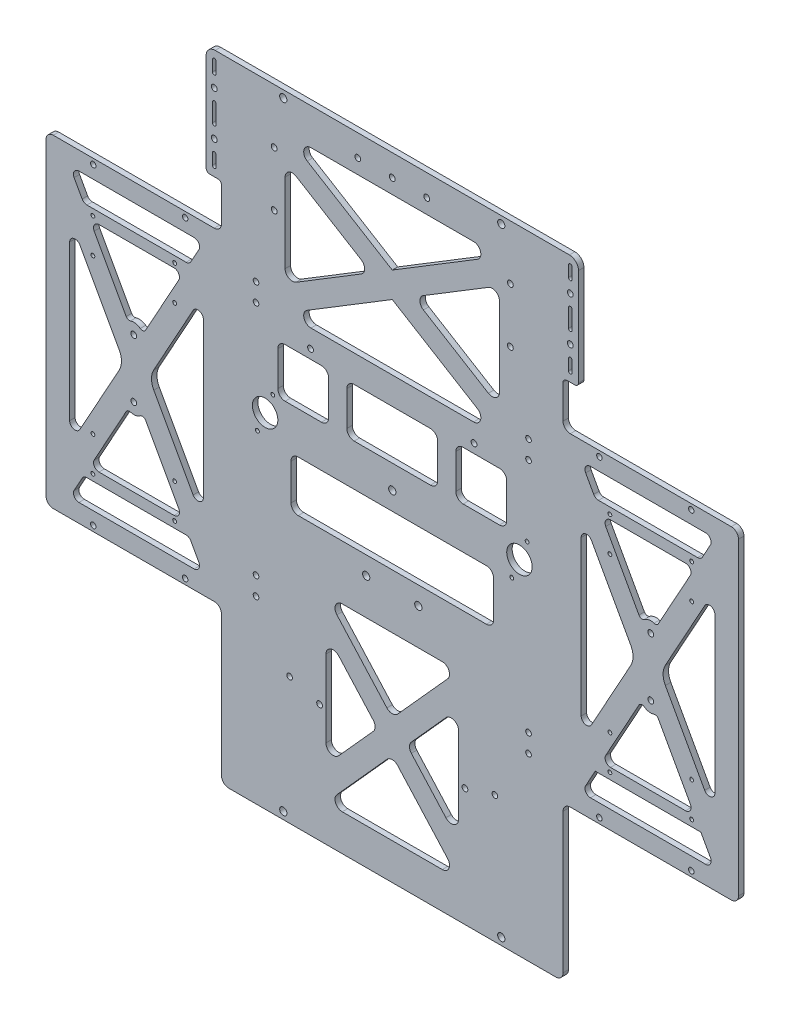
from build123d import *

# Parameters (mm, degrees)
EXTRUDE_1_DEPTH      = 3
SKETCH_2_R           = 1.5
SKETCH_2_W           = 73.6
SKETCH_2_H           = 158
CUT_EXTRUDE_1_DEPTH  = 259.095641188
SKETCH_3_R           = 1.6
SKETCH_3_R_2         = 1.05
EXTRUDE_2_DEPTH      = 3
FILLET_2_R           = 4
SKETCH_4_R           = 2
CUT_EXTRUDE_2_DEPTH  = 259.095641188
FILLET_3_R           = 2
FILLET_4_R           = 3
FILLET_5_R           = 10
SKETCH_19_W          = 8.5
SKETCH_19_H          = 60.5
EXTRUDE_3_DEPTH      = 3
SKETCH_20_W          = 2
SKETCH_20_H          = 6
SKETCH_20_H_2        = 10
CUT_EXTRUDE_13_DEPTH = 259.095641188
SKETCH_22_R          = 1.6
SKETCH_22_R_2        = 1
CUT_EXTRUDE_14_DEPTH = 259.095641188
SKETCH_23_R          = 1.6
SKETCH_23_R_2        = 2
SKETCH_23_R_3        = 1.05
SKETCH_23_R_4        = 1.55
SKETCH_23_R_5        = 7
CUT_EXTRUDE_15_DEPTH = 259.095641188
SKETCH_24_R          = 1.55
CUT_EXTRUDE_16_DEPTH = 259.095641188
SKETCH_26_W          = 118
SKETCH_26_H          = 86
SKETCH_26_W_2        = 126
SKETCH_26_H_2        = 27
SKETCH_26_W_3        = 111.55
SKETCH_26_H_3        = 27.9
SKETCH_26_W_4        = 73
SKETCH_26_H_4        = 99.1
CUT_EXTRUDE_17_DEPTH = 259.095641188
SKETCH_27_W          = 10
SKETCH_27_H          = 27
EXTRUDE_4_DEPTH      = 3
FILLET_6_R           = 4
FILLET_7_R           = 2
FILLET_8_R           = 5
SKETCH_29_R          = 1.6
CUT_EXTRUDE_18_DEPTH = 259.095641188
SKETCH_30_R          = 1.6
CUT_EXTRUDE_19_DEPTH = 259.095641188


with BuildPart() as part:
    # 草图1 → 凸台-拉伸1 (new body)
    with BuildSketch(Plane.XY):
        Polygon((-94, -89), (-94, -174), (94, -174), (94, -89), (190.6, -89), (190.6, 89), (94, 89), (94, 174), (-94, 174), (-94, 89), (-190.6, 89), (-190.6, -89), align=None)
    extrude(amount=EXTRUDE_1_DEPTH)

    # 草图2 → 切除-拉伸1 (cut, through all)
    with BuildSketch(Plane.XY.offset(3)):
        with Locations((164.6, 86)):
            Circle(SKETCH_2_R)
        with Locations((164.6, -86)):
            Circle(SKETCH_2_R)
        with Locations((-60, -170)):
            Circle(SKETCH_2_R)
        with Locations((60, -170)):
            Circle(SKETCH_2_R)
        with Locations((-164.6, -86)):
            Circle(SKETCH_2_R)
        with Locations((-164.6, 86)):
            Circle(SKETCH_2_R)
        with Locations((-60, 170)):
            Circle(SKETCH_2_R)
        with Locations((60, 170)):
            Circle(SKETCH_2_R)
        with Locations((-114, 86)):
            Circle(SKETCH_2_R)
        with Locations((-114, -86)):
            Circle(SKETCH_2_R)
        with Locations((114, 86)):
            Circle(SKETCH_2_R)
        with Locations((114, -86)):
            Circle(SKETCH_2_R)
        with Locations((-140.8, 0)):
            Rectangle(SKETCH_2_W, SKETCH_2_H)
        with Locations((140.8, 0)):
            Rectangle(SKETCH_2_W, SKETCH_2_H)
    extrude(amount=-CUT_EXTRUDE_1_DEPTH, mode=Mode.SUBTRACT)

    # 草图3 → 凸台-拉伸2 (add)
    # profile 1 of 2: a face of its own
    with BuildSketch(Plane.XY.offset(3)):
        Polygon((-177.6, 79), (-169.863644358, 65), (-111.736355642, 65), (-104, 79), (-104, 54.189326828), (-133.944850308, 0), (-104, -54.189326828), (-104, -79), (-111.736355642, -65), (-169.863644358, -65), (-177.6, -79), (-177.6, -54.189326828), (-147.655149692, 0), (-177.6, 54.189326828), align=None)
        with Locations((-142.3, 16)):
            Circle(SKETCH_3_R, mode=Mode.SUBTRACT)
        with Locations((-164.8, 61.5)):
            Circle(SKETCH_3_R_2, mode=Mode.SUBTRACT)
        with Locations((-119.8, 61.5)):
            Circle(SKETCH_3_R_2, mode=Mode.SUBTRACT)
        with Locations((-119.8, 42.5)):
            Circle(SKETCH_3_R_2, mode=Mode.SUBTRACT)
        with Locations((-164.8, 42.5)):
            Circle(SKETCH_3_R_2, mode=Mode.SUBTRACT)
        with Locations((-142.3, -16)):
            Circle(SKETCH_3_R, mode=Mode.SUBTRACT)
        with Locations((-119.8, -42.5)):
            Circle(SKETCH_3_R_2, mode=Mode.SUBTRACT)
        with Locations((-164.8, -42.5)):
            Circle(SKETCH_3_R_2, mode=Mode.SUBTRACT)
        with Locations((-119.8, -61.5)):
            Circle(SKETCH_3_R_2, mode=Mode.SUBTRACT)
        with Locations((-164.8, -61.5)):
            Circle(SKETCH_3_R_2, mode=Mode.SUBTRACT)
        with BuildLine():
            Line((-166.548063369, 59), (-115.051936631, 59))
            Line((-115.051936631, 59), (-137.130529886, 19.045747649))
            ThreePointArc((-137.130529886, 19.045747649), (-140.924767783, 21.840268517), (-145.567279017, 21.032383911))
            Line((-145.567279017, 21.032383911), (-166.548063369, 59))
        make_face(mode=Mode.SUBTRACT)
        with BuildLine():
            Line((-166.548063369, -59), (-115.051936631, -59))
            Line((-115.051936631, -59), (-137.130529886, -19.045747649))
            ThreePointArc((-137.130529886, -19.045747649), (-140.924767783, -21.840268517), (-145.567279017, -21.032383911))
            Line((-145.567279017, -21.032383911), (-166.548063369, -59))
        make_face(mode=Mode.SUBTRACT)
    # profile 2 of 2: a face of its own
    with BuildSketch(Plane.XY.offset(3)):
        Polygon((169.863644358, -65), (111.736355642, -65), (104, -79), (104, -54.189326828), (133.944850308, 0), (104, 54.189326828), (104, 79), (111.736355642, 65), (169.863644358, 65), (177.6, 79), (177.6, 54.189326828), (147.655149692, 0), (177.6, -54.189326828), (177.6, -79), align=None)
        with Locations((164.8, -61.5)):
            Circle(SKETCH_3_R_2, mode=Mode.SUBTRACT)
        with Locations((119.8, -61.5)):
            Circle(SKETCH_3_R_2, mode=Mode.SUBTRACT)
        with Locations((164.8, -42.5)):
            Circle(SKETCH_3_R_2, mode=Mode.SUBTRACT)
        with Locations((119.8, -42.5)):
            Circle(SKETCH_3_R_2, mode=Mode.SUBTRACT)
        with Locations((142.3, -16)):
            Circle(SKETCH_3_R, mode=Mode.SUBTRACT)
        with Locations((164.8, 42.5)):
            Circle(SKETCH_3_R_2, mode=Mode.SUBTRACT)
        with Locations((119.8, 42.5)):
            Circle(SKETCH_3_R_2, mode=Mode.SUBTRACT)
        with Locations((119.8, 61.5)):
            Circle(SKETCH_3_R_2, mode=Mode.SUBTRACT)
        with Locations((164.8, 61.5)):
            Circle(SKETCH_3_R_2, mode=Mode.SUBTRACT)
        with Locations((142.3, 16)):
            Circle(SKETCH_3_R, mode=Mode.SUBTRACT)
        with BuildLine():
            Line((166.548063369, -59), (145.567279017, -21.032383911))
            ThreePointArc((145.567279017, -21.032383911), (140.924767783, -21.840268517), (137.130529886, -19.045747649))
            Line((137.130529886, -19.045747649), (115.051936631, -59))
            Line((115.051936631, -59), (166.548063369, -59))
        make_face(mode=Mode.SUBTRACT)
        with BuildLine():
            Line((166.548063369, 59), (145.567279017, 21.032383911))
            ThreePointArc((145.567279017, 21.032383911), (140.924767783, 21.840268517), (137.130529886, 19.045747649))
            Line((137.130529886, 19.045747649), (115.051936631, 59))
            Line((115.051936631, 59), (166.548063369, 59))
        make_face(mode=Mode.SUBTRACT)
    extrude(amount=-EXTRUDE_2_DEPTH)

    # 圆角2
    fillet_2_edges = [part.edges().sort_by_distance(p)[0] for p in [
        (94, -174, 1.5),
        (-94, -174, 1.5),
        (-94, -89, 1.5),
        (-190.6, -89, 1.5),
        (-190.6, 89, 1.5),
        (-94, 89, 1.5),
        (94, 89, 1.5),
        (190.6, 89, 1.5),
        (190.6, -89, 1.5),
        (94, -89, 1.5),
    ]]
    fillet(fillet_2_edges, radius=FILLET_2_R)

    # 草图4 → 切除-拉伸2 (cut, through all)
    with BuildSketch(Plane.XY.offset(3)):
        with Locations((-60, 170)):
            Circle(SKETCH_4_R)
        with Locations((60, 170)):
            Circle(SKETCH_4_R)
        with Locations((-60, -170)):
            Circle(SKETCH_4_R)
        with Locations((60, -170)):
            Circle(SKETCH_4_R)
    extrude(amount=-CUT_EXTRUDE_2_DEPTH, mode=Mode.SUBTRACT)

    # 圆角3
    fillet_3_edges = [part.edges().sort_by_distance(p)[0] for p in [
        (-137.130529886, 19.045747649, 1.5),
        (-145.567279017, 21.032383911, 1.5),
        (-145.567279017, -21.032383911, 1.5),
        (-137.130529886, -19.045747649, 1.5),
        (137.130529886, -19.045747649, 1.5),
        (145.567279017, -21.032383911, 1.5),
        (145.567279017, 21.032383911, 1.5),
        (137.130529886, 19.045747649, 1.5),
    ]]
    fillet(fillet_3_edges, radius=FILLET_3_R)

    # 圆角4
    fillet_4_edges = [part.edges().sort_by_distance(p)[0] for p in [
        (-177.6, -54.189326828, 1.5),
        (-169.863644358, -65, 1.5),
        (-111.736355642, -65, 1.5),
        (-104, -54.189326828, 1.5),
        (-104, 54.189326828, 1.5),
        (-111.736355642, 65, 1.5),
        (-169.863644358, 65, 1.5),
        (-177.6, 54.189326828, 1.5),
        (-115.051936631, 59, 1.5),
        (-166.548063369, 59, 1.5),
        (-166.548063369, -59, 1.5),
        (-115.051936631, -59, 1.5),
        (177.6, 54.189326828, 1.5),
        (169.863644358, 65, 1.5),
        (111.736355642, 65, 1.5),
        (104, 54.189326828, 1.5),
        (104, -54.189326828, 1.5),
        (177.6, -54.189326828, 1.5),
        (115.051936631, -59, 1.5),
        (166.548063369, -59, 1.5),
        (166.548063369, 59, 1.5),
        (115.051936631, 59, 1.5),
        (-104, 79, 1.5),
        (-104, -79, 1.5),
        (-177.6, -79, 1.5),
        (-177.6, 79, 1.5),
        (177.6, 79, 1.5),
        (177.6, -79, 1.5),
        (104, -79, 1.5),
        (104, 79, 1.5),
    ]]
    fillet(fillet_4_edges, radius=FILLET_4_R)

    # 圆角5
    fillet_5_edges = [part.edges().sort_by_distance(p)[0] for p in [
        (-147.655149692, 0, 1.5),
        (-133.944850308, 0, 1.5),
        (133.944850308, 0, 1.5),
        (147.655149692, 0, 1.5),
    ]]
    fillet(fillet_5_edges, radius=FILLET_5_R)

    # 草图19 → 凸台-拉伸3 (add)
    with BuildSketch(Plane(origin=(0, 0, 0), x_dir=(-1, 0, 0), z_dir=(0, 0, -1))):
        with Locations((-98.25, 143.75)):
            Rectangle(SKETCH_19_W, SKETCH_19_H)
        with Locations((98.25, 143.75)):
            Rectangle(SKETCH_19_W, SKETCH_19_H)
    extrude(amount=-EXTRUDE_3_DEPTH)

    # 草图20 → 切除-拉伸13 (cut, through all)
    with BuildSketch(Plane(origin=(0, 0, 0), x_dir=(-1, 0, 0), z_dir=(0, 0, -1))):
        with Locations((-98, 166)):
            Rectangle(SKETCH_20_W, SKETCH_20_H)
        with Locations((-98, 143.75)):
            Rectangle(SKETCH_20_W, SKETCH_20_H_2)
        with Locations((-98, 121.5)):
            Rectangle(SKETCH_20_W, SKETCH_20_H)
        with Locations((98, 121.5)):
            Rectangle(SKETCH_20_W, SKETCH_20_H)
        with Locations((98, 143.75)):
            Rectangle(SKETCH_20_W, SKETCH_20_H_2)
        with Locations((98, 166)):
            Rectangle(SKETCH_20_W, SKETCH_20_H)
    extrude(amount=-CUT_EXTRUDE_13_DEPTH, mode=Mode.SUBTRACT)

    # 草图22 → 切除-拉伸14 (cut, through all)
    with BuildSketch(Plane(origin=(0, 0, 0), x_dir=(-1, 0, 0), z_dir=(0, 0, -1))):
        with Locations((-98, 155.875)):
            Circle(SKETCH_22_R)
        with Locations((-98, 131.625)):
            Circle(SKETCH_22_R)
        with Locations((-98, 169)):
            Circle(SKETCH_22_R_2)
        with Locations((-98, 163)):
            Circle(SKETCH_22_R_2)
        with Locations((-98, 148.75)):
            Circle(SKETCH_22_R_2)
        with Locations((-98, 138.75)):
            Circle(SKETCH_22_R_2)
        with Locations((-98, 124.5)):
            Circle(SKETCH_22_R_2)
        with Locations((-98, 118.5)):
            Circle(SKETCH_22_R_2)
        with Locations((98, 169)):
            Circle(SKETCH_22_R_2)
        with Locations((98, 163)):
            Circle(SKETCH_22_R_2)
        with Locations(Location((98, 155.875, 0), (0, 0, 180))):
            Circle(SKETCH_22_R)
        with Locations((98, 148.75)):
            Circle(SKETCH_22_R_2)
        with Locations((98, 138.75)):
            Circle(SKETCH_22_R_2)
        with Locations(Location((98, 131.625, 0), (0, 0, 180))):
            Circle(SKETCH_22_R)
        with Locations((98, 124.5)):
            Circle(SKETCH_22_R_2)
        with Locations((98, 118.5)):
            Circle(SKETCH_22_R_2)
    extrude(amount=-CUT_EXTRUDE_14_DEPTH, mode=Mode.SUBTRACT)

    # 草图23 → 切除-拉伸15 (cut, through all)
    with BuildSketch(Plane(origin=(0, 0, 0), x_dir=(-1, 0, 0), z_dir=(0, 0, -1))):
        with Locations((-65, 144)):
            Circle(SKETCH_23_R)
        with Locations((65, 144)):
            Circle(SKETCH_23_R)
        with Locations((-65, 114)):
            Circle(SKETCH_23_R)
        with Locations((65, 114)):
            Circle(SKETCH_23_R)
        with Locations((0, 13)):
            Circle(SKETCH_23_R_2)
        with Locations((-14.35, -34.9)):
            Circle(SKETCH_23_R_2)
        with Locations((14.35, -34.9)):
            Circle(SKETCH_23_R_2)
        with Locations((-74.225, 25.685)):
            Circle(SKETCH_23_R_3)
        with Locations((-65.775, 4.315)):
            Circle(SKETCH_23_R_3)
        with Locations((65.775, 25.685)):
            Circle(SKETCH_23_R_3)
        with Locations((74.225, 4.315)):
            Circle(SKETCH_23_R_3)
        with Locations((-45, 58)):
            Circle(SKETCH_23_R)
        with Locations((45, 58)):
            Circle(SKETCH_23_R)
        with Locations((-56.5, -104)):
            Circle(SKETCH_23_R_4)
        with Locations((56.5, -104)):
            Circle(SKETCH_23_R_4)
        with Locations((-70, 15)):
            Circle(SKETCH_23_R_5)
        with Locations((70, 15)):
            Circle(SKETCH_23_R_5)
    extrude(amount=-CUT_EXTRUDE_15_DEPTH, mode=Mode.SUBTRACT)

    # 草图24 → 切除-拉伸16 (cut, through all)
    with BuildSketch(Plane(origin=(0, 0, 0), x_dir=(-1, 0, 0), z_dir=(0, 0, -1))):
        with Locations((-75, 75)):
            Circle(SKETCH_24_R)
        with Locations((-75, 65)):
            Circle(SKETCH_24_R)
        with Locations((-75, -65)):
            Circle(SKETCH_24_R)
        with Locations((-75, -75)):
            Circle(SKETCH_24_R)
        with Locations(Location((75, -65, 0), (0, 0, 180))):
            Circle(SKETCH_24_R)
        with Locations(Location((75, -75, 0), (0, 0, 180))):
            Circle(SKETCH_24_R)
        with Locations(Location((75, 75, 0), (0, 0, 180))):
            Circle(SKETCH_24_R)
        with Locations(Location((75, 65, 0), (0, 0, 180))):
            Circle(SKETCH_24_R)
    extrude(amount=-CUT_EXTRUDE_16_DEPTH, mode=Mode.SUBTRACT)

    # 草图26 → 切除-拉伸17 (cut, through all)
    with BuildSketch(Plane(origin=(0, 0, 0), x_dir=(-1, 0, 0), z_dir=(0, 0, -1))):
        with Locations((0, 111)):
            Rectangle(SKETCH_26_W, SKETCH_26_H)
        with Locations((0, 39.5)):
            Rectangle(SKETCH_26_W_2, SKETCH_26_H_2)
        with Locations((0, -10.95)):
            Rectangle(SKETCH_26_W_3, SKETCH_26_H_3)
        with Locations((0, -104.45)):
            Rectangle(SKETCH_26_W_4, SKETCH_26_H_4)
    extrude(amount=-CUT_EXTRUDE_17_DEPTH, mode=Mode.SUBTRACT)

    # 草图27 → 凸台-拉伸4 (add)
    with BuildSketch(Plane(origin=(0, 0, 0), x_dir=(-1, 0, 0), z_dir=(0, 0, -1))):
        Polygon((-59, 154), (0, 118.027285105), (59, 154), (59, 139.945429791), (11.525675012, 111), (59, 82.054570209), (59, 68), (0, 103.972714895), (-59, 68), (-59, 82.054570209), (-11.525675012, 111), (-59, 139.945429791), align=None)
        with Locations((-30, 39.5)):
            Rectangle(SKETCH_27_W, SKETCH_27_H)
        Polygon((-36.5, -54.9), (0, -95.478155568), (36.5, -54.9), (36.5, -72.843688865), (8.070162806, -104.45), (36.5, -136.056311135), (36.5, -154), (0, -113.421844432), (-36.5, -154), (-36.5, -136.056311135), (-8.070162806, -104.45), (-36.5, -72.843688865), align=None)
        with Locations((30, 39.5)):
            Rectangle(SKETCH_27_W, SKETCH_27_H)
    extrude(amount=-EXTRUDE_4_DEPTH)

    # 圆角6
    fillet_6_edges = [part.edges().sort_by_distance(p)[0] for p in [
        (-59, 154, 1.5),
        (-59, 68, 1.5),
        (59, 68, 1.5),
        (59, 154, 1.5),
        (-63, 53, 1.5),
        (-63, 26, 1.5),
        (63, 26, 1.5),
        (63, 53, 1.5),
        (-55.775, 3, 1.5),
        (-55.775, -24.9, 1.5),
        (55.775, -24.9, 1.5),
        (55.775, 3, 1.5),
        (-36.5, -54.9, 1.5),
        (-36.5, -154, 1.5),
        (36.5, -154, 1.5),
        (36.5, -54.9, 1.5),
        (11.525675012, 111, 1.5),
        (59, 82.054570209, 1.5),
        (-59, 82.054570209, 1.5),
        (-11.525675012, 111, 1.5),
        (-59, 139.945429791, 1.5),
        (59, 139.945429791, 1.5),
        (25, 26, 1.5),
        (25, 53, 1.5),
        (35, 53, 1.5),
        (35, 26, 1.5),
        (-35, 26, 1.5),
        (-35, 53, 1.5),
        (-25, 53, 1.5),
        (-25, 26, 1.5),
        (8.070162806, -104.45, 1.5),
        (36.5, -136.056311135, 1.5),
        (0, -113.421844432, 1.5),
        (-36.5, -136.056311135, 1.5),
        (-8.070162806, -104.45, 1.5),
        (-36.5, -72.843688865, 1.5),
        (0, -95.478155568, 1.5),
        (36.5, -72.843688865, 1.5),
    ]]
    fillet(fillet_6_edges, radius=FILLET_6_R)

    # 圆角7
    fillet_7_edges = [part.edges().sort_by_distance(p)[0] for p in [
        (102.5, 113.5, 1.5),
        (94, 113.5, 1.5),
        (-102.5, 113.5, 1.5),
        (-94, 113.5, 1.5),
    ]]
    fillet(fillet_7_edges, radius=FILLET_7_R)

    # 圆角8
    fillet_8_edges = [part.edges().sort_by_distance(p)[0] for p in [
        (102.5, 174, 1.5),
        (-102.5, 174, 1.5),
    ]]
    fillet(fillet_8_edges, radius=FILLET_8_R)

    # 草图29 → 切除-拉伸18 (cut, through all)
    with BuildSketch(Plane(origin=(0, 0, 0), x_dir=(-1, 0, 0), z_dir=(0, 0, -1))):
        with Locations((-19, 162)):
            Circle(SKETCH_29_R)
        with Locations((19, 162)):
            Circle(SKETCH_29_R)
        with Locations((0, 162)):
            Circle(SKETCH_29_R)
    extrude(amount=-CUT_EXTRUDE_18_DEPTH, mode=Mode.SUBTRACT)

    # 草图30 → 切除-拉伸19 (cut, through all)
    with BuildSketch(Plane(origin=(0, 0, 0), x_dir=(-1, 0, 0), z_dir=(0, 0, -1))):
        with Locations((-40, -109)):
            Circle(SKETCH_30_R)
        with Locations((40, -109)):
            Circle(SKETCH_30_R)
    extrude(amount=-CUT_EXTRUDE_19_DEPTH, mode=Mode.SUBTRACT)


solid = part.part
